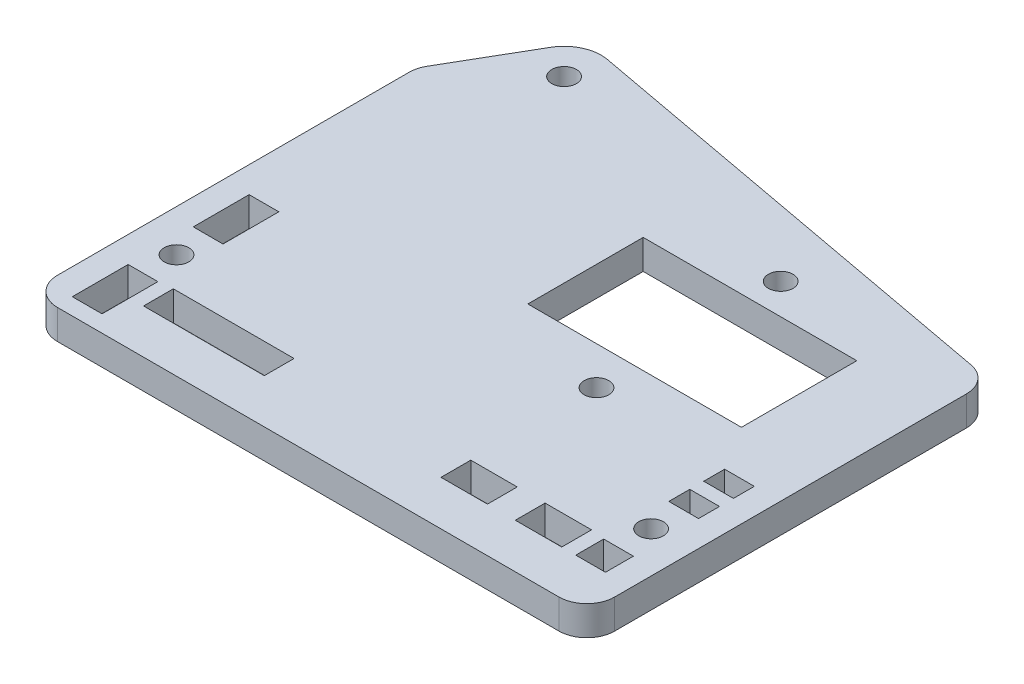
from build123d import *

# Parameters (mm, degrees)
SKETCH1_W           = 3.194434014
SKETCH1_H           = 6.000224533
SKETCH1_W_2         = 12.976803263
SKETCH1_H_2         = 3.200223762
SKETCH1_R           = 1.323033288
SKETCH1_H_3         = 6.000288014
SKETCH1_W_3         = 4.991186163
SKETCH1_H_4         = 3.200091917
SKETCH1_W_4         = 4.990971694
SKETCH1_W_5         = 3.194492506
SKETCH1_H_5         = 3.000146449
SKETCH1_H_6         = 2.247069465
SKETCH1_W_6         = 22.959409558
SKETCH1_H_7         = 12.40053533
BOSS_EXTRUDE1_DEPTH = 3.175


with BuildPart() as part:
    # Sketch1 → Boss-Extrude1 (new body)
    with BuildSketch(Plane(origin=(0, 0, 0), x_dir=(1, 0, 0), z_dir=(0, 1, 0))):
        with BuildLine():
            Line((-28.456084878, -27.532431428), (25.442900716, -27.532431428))
            ThreePointArc((25.442900716, -27.532431428), (27.560473935, -26.65530708), (28.437609204, -24.537738386))
            Line((28.437609204, -24.537738386), (28.437804204, 13.268980227))
            ThreePointArc((28.437804204, 13.268980227), (27.743957441, 15.188191581), (25.983223234, 16.219991273))
            Line((25.983223234, 16.219991273), (-21.997773241, 25.107497345))
            ThreePointArc((-21.997773241, 25.107497345), (-24.390968499, 24.809261571), (-26.174789125, 23.186205164))
            Line((-26.174789125, 23.186205164), (-31.050867612, 14.775968165))
            ThreePointArc((-31.050867612, 14.775968165), (-31.352979308, 14.049412081), (-31.456040564, 13.269326446))
            Line((-31.456040564, 13.269326446), (-31.456040564, -24.532475742))
            ThreePointArc((-31.456040564, -24.532475742), (-30.577373887, -26.653764751), (-28.456084878, -27.532431428))
        make_face()
        with Locations((-27.063830276, -22.732321631)):
            Rectangle(SKETCH1_W, SKETCH1_H, mode=Mode.SUBTRACT)
        with Locations((-17.481737065, -21.16687035)):
            Rectangle(SKETCH1_W_2, SKETCH1_H_2, mode=Mode.SUBTRACT)
        with Locations((-26.963965218, -16.232064957)):
            Circle(SKETCH1_R, mode=Mode.SUBTRACT)
        with Locations((-27.063830275, -9.731776544)):
            Rectangle(SKETCH1_W, SKETCH1_H_3, mode=Mode.SUBTRACT)
        with Locations((10.460708795, -21.132309856)):
            Rectangle(SKETCH1_W_3, SKETCH1_H_4, mode=Mode.SUBTRACT)
        with Locations((18.446511119, -21.132309856)):
            Rectangle(SKETCH1_W_4, SKETCH1_H_4, mode=Mode.SUBTRACT)
        with Locations((24.045427435, -21.232282591)):
            Rectangle(SKETCH1_W_5, SKETCH1_H_5, mode=Mode.SUBTRACT)
        with Locations((24.045515173, -16.23206496)):
            Circle(SKETCH1_R, mode=Mode.SUBTRACT)
        with Locations((7.974006472, -6.031549942)):
            Circle(SKETCH1_R, mode=Mode.SUBTRACT)
        Polygon((22.448181182, -10.484914569), (22.448181182, -10.478708085), (25.642673688, -10.478708085), (25.642673688, -12.731920553), (22.448181182, -12.731920553), align=None, mode=Mode.SUBTRACT)
        with Locations((24.045427436, -7.855167272)):
            Rectangle(SKETCH1_W_5, SKETCH1_H_6, mode=Mode.SUBTRACT)
        with Locations((-22.724218332, 21.185636807)):
            Circle(SKETCH1_R, mode=Mode.SUBTRACT)
        with Locations((7.974006472, 4.268713184)):
            Rectangle(SKETCH1_W_6, SKETCH1_H_7, mode=Mode.SUBTRACT)
        with Locations((7.974006473, 13.76898446)):
            Circle(SKETCH1_R, mode=Mode.SUBTRACT)
    extrude(amount=BOSS_EXTRUDE1_DEPTH)


solid = part.part
